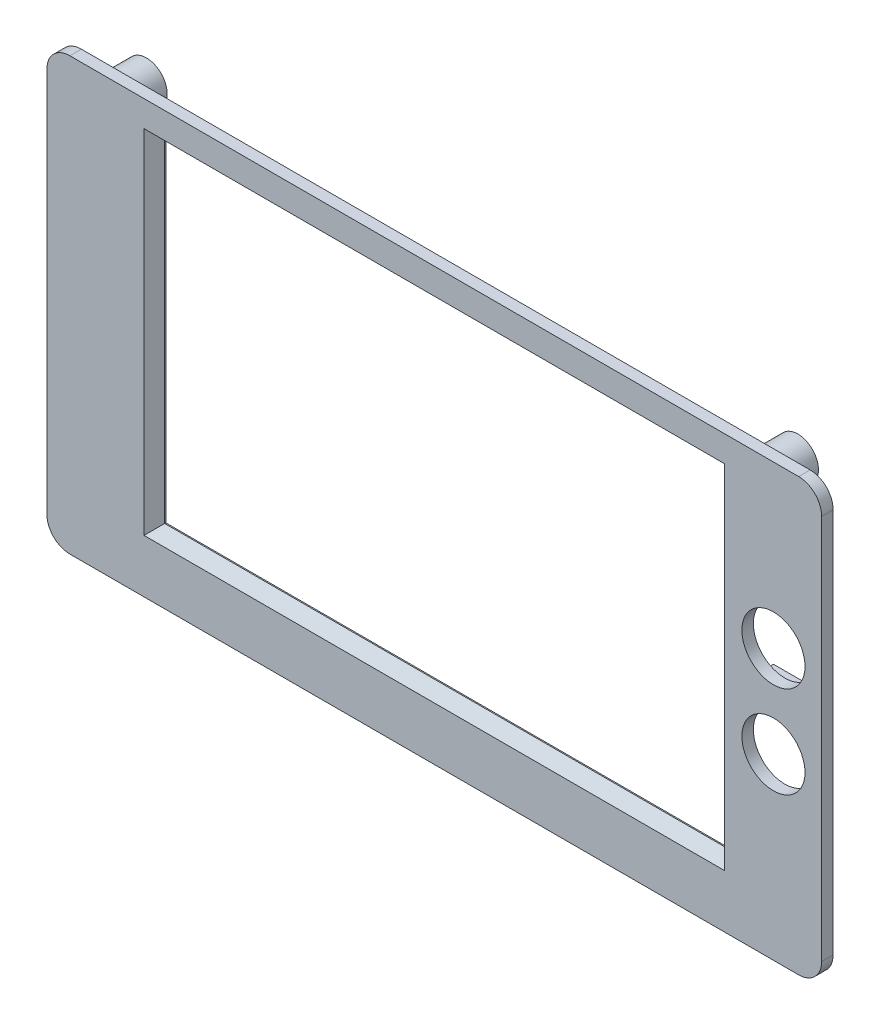
from build123d import *

# Parameters (mm, degrees)
SKETCH_3_W            = 95.96
SKETCH_3_H            = 56.19
EXTRUDE_2_DEPTH       = 2
SKETCH_4_W            = 97.56
SKETCH_4_H            = 57.79
SKETCH_4_W_2          = 95.96
SKETCH_4_H_2          = 56.19
CUT_EXTRUDE_1_DEPTH   = 2
SKETCH_5_R            = 3.6
SKETCH_5_R_2          = 2.4
EXTRUDE_1_DEPTH       = 4.6
EXTRUDE_START         = -2
EXTRUDE_3_DEPTH       = 2
CHAMFER_1_SIZE        = 1.8
SKETCH_8_W            = 10
SKETCH_8_H            = 75.2
EXTRUDE_3_2_DEPTH     = 2
FILLET_1_R            = 4
SKETCH_9_R            = 5.5
CUT_EXTRUDE_1_2_DEPTH = 2
SKETCH_11_R           = 2.4
SKETCH_11_R_2         = 1
EXTRUDE_4_DEPTH       = 4.6
SKETCH_14_W           = 10
SKETCH_14_H           = 1
EXTRUDE_4_2_DEPTH     = 3
CHAMFER_2_SIZE        = 3
CHAMFER_3_SIZE        = 3


with BuildPart() as part:
    # Эскиз3 → Бобышка-Вытянуть2 (new body)
    with BuildSketch(Plane.XY):
        with BuildLine():
            Line((-57.5, -37), (57.5, -37))
            ThreePointArc((57.5, -37), (59.267766953, -36.267766953), (60, -34.5))
            Line((60, -34.5), (60, 34.5))
            ThreePointArc((60, 34.5), (59.267766953, 36.267766953), (57.5, 37))
            Line((57.5, 37), (-57.5, 37))
            ThreePointArc((-57.5, 37), (-59.267766953, 36.267766953), (-60, 34.5))
            Line((-60, 34.5), (-60, -34.5))
            ThreePointArc((-60, -34.5), (-59.267766953, -36.267766953), (-57.5, -37))
        make_face()
        with Locations((0, 2.375)):
            Rectangle(SKETCH_3_W, SKETCH_3_H, mode=Mode.SUBTRACT)
    extrude(amount=EXTRUDE_2_DEPTH)

    # Эскиз4 → Cut-Extrude 1 (cut)
    with BuildSketch(Plane.XY.offset(2)):
        with Locations((0, 2.375)):
            Rectangle(SKETCH_4_W, SKETCH_4_H)
        with Locations((0, 2.375)):
            Rectangle(SKETCH_4_W_2, SKETCH_4_H_2, mode=Mode.SUBTRACT)
    extrude(amount=-CUT_EXTRUDE_1_DEPTH, mode=Mode.SUBTRACT)

    # Эскиз5 → Вытянуть-Тонкостенный1 (add)
    # profile 1 of 4: a face of its own
    with BuildSketch(Plane(origin=(0, 0, 0), x_dir=(-1, 0, 0), z_dir=(0, 0, -1))):
        with Locations((56.75, 33.75)):
            Circle(SKETCH_5_R)
        with Locations((56.75, 33.75)):
            Circle(SKETCH_5_R_2, mode=Mode.SUBTRACT)
    # profile 2 of 4: a face of its own
    with BuildSketch(Plane(origin=(0, 0, 0), x_dir=(-1, 0, 0), z_dir=(0, 0, -1))):
        with Locations((-56.75, 33.75)):
            Circle(SKETCH_5_R)
        with Locations((-56.75, 33.75)):
            Circle(SKETCH_5_R_2, mode=Mode.SUBTRACT)
    # profile 3 of 4: a face of its own
    with BuildSketch(Plane(origin=(0, 0, 0), x_dir=(-1, 0, 0), z_dir=(0, 0, -1))):
        with Locations((-56.75, -33.75)):
            Circle(SKETCH_5_R)
        with Locations((-56.75, -33.75)):
            Circle(SKETCH_5_R_2, mode=Mode.SUBTRACT)
    # profile 4 of 4: a face of its own
    with BuildSketch(Plane(origin=(0, 0, 0), x_dir=(-1, 0, 0), z_dir=(0, 0, -1))):
        with Locations((56.75, -33.75)):
            Circle(SKETCH_5_R)
        with Locations((56.75, -33.75)):
            Circle(SKETCH_5_R_2, mode=Mode.SUBTRACT)
    extrude(amount=EXTRUDE_1_DEPTH)

    # Эскиз7 → Extrude 3 (add)
    with BuildSketch(Plane.XY.offset(2).offset(EXTRUDE_START)):
        with BuildLine():
            Line((-60.6, 34.5), (-60.6, -34.5))
            ThreePointArc((-60.6, -34.5), (-59.692031022, -36.692031022), (-57.5, -37.6))
            Line((-57.5, -37.6), (57.5, -37.6))
            ThreePointArc((57.5, -37.6), (59.692031022, -36.692031022), (60.6, -34.5))
            Line((60.6, -34.5), (60.6, 34.5))
            ThreePointArc((60.6, 34.5), (59.692031022, 36.692031022), (57.5, 37.6))
            Line((57.5, 37.6), (-57.5, 37.6))
            ThreePointArc((-57.5, 37.6), (-59.692031022, 36.692031022), (-60.6, 34.5))
        make_face()
        with BuildLine():
            Line((-60, 34.5), (-60, -34.5))
            ThreePointArc((-60, -34.5), (-59.267766953, -36.267766953), (-57.5, -37))
            Line((-57.5, -37), (57.5, -37))
            ThreePointArc((57.5, -37), (59.267766953, -36.267766953), (60, -34.5))
            Line((60, -34.5), (60, 34.5))
            ThreePointArc((60, 34.5), (59.267766953, 36.267766953), (57.5, 37))
            Line((57.5, 37), (-57.5, 37))
            ThreePointArc((-57.5, 37), (-59.267766953, 36.267766953), (-60, 34.5))
        make_face(mode=Mode.SUBTRACT)
    extrude(amount=EXTRUDE_3_DEPTH)

    # Фаска1
    chamfer_1_edges = [part.edges().sort_by_distance(p)[0] for p in [
        (0, 31.27, 2),
        (-48.78, 2.375, 2),
        (0, -26.52, 2),
        (48.78, 2.375, 2),
    ]]
    chamfer(chamfer_1_edges, length=CHAMFER_1_SIZE)

    # Эскиз8 → Extrude 3 2 (add)
    with BuildSketch(Plane.XY.offset(2)):
        with Locations((62.5, 0)):
            Rectangle(SKETCH_8_W, SKETCH_8_H)
        with Locations((-62.5, 0)):
            Rectangle(SKETCH_8_W, SKETCH_8_H)
    extrude(amount=-EXTRUDE_3_2_DEPTH)

    # Скругление1
    fillet_1_edges = [part.edges().sort_by_distance(p)[0] for p in [
        (67.5, 37.6, 1),
        (67.5, -37.6, 1),
        (-67.5, -37.6, 1),
        (-67.5, 37.6, 1),
    ]]
    fillet(fillet_1_edges, radius=FILLET_1_R)

    # Эскиз9 → Cut-Extrude 1 2 (cut)
    with BuildSketch(Plane.XY.offset(2)):
        with Locations((59.1, 9.48)):
            Circle(SKETCH_9_R)
        with Locations((59.1, -6.52)):
            Circle(SKETCH_9_R)
    extrude(amount=-CUT_EXTRUDE_1_2_DEPTH, mode=Mode.SUBTRACT)

    # Эскиз11 → Extrude 4 (add)
    # profile 1 of 4: a face of its own
    with BuildSketch(Plane(origin=(0, 0, 0), x_dir=(-1, 0, 0), z_dir=(0, 0, -1))):
        with Locations((-56.75, 33.75)):
            Circle(SKETCH_11_R)
        with Locations((-56.75, 33.75)):
            Circle(SKETCH_11_R_2, mode=Mode.SUBTRACT)
    # profile 2 of 4: a face of its own
    with BuildSketch(Plane(origin=(0, 0, 0), x_dir=(-1, 0, 0), z_dir=(0, 0, -1))):
        with Locations((56.75, 33.75)):
            Circle(SKETCH_11_R)
        with Locations((56.75, 33.75)):
            Circle(SKETCH_11_R_2, mode=Mode.SUBTRACT)
    # profile 3 of 4: a face of its own
    with BuildSketch(Plane(origin=(0, 0, 0), x_dir=(-1, 0, 0), z_dir=(0, 0, -1))):
        with Locations((56.75, -33.75)):
            Circle(SKETCH_11_R)
        with Locations((56.75, -33.75)):
            Circle(SKETCH_11_R_2, mode=Mode.SUBTRACT)
    # profile 4 of 4: a face of its own
    with BuildSketch(Plane(origin=(0, 0, 0), x_dir=(-1, 0, 0), z_dir=(0, 0, -1))):
        with Locations((-56.75, -33.75)):
            Circle(SKETCH_11_R)
        with Locations((-56.75, -33.75)):
            Circle(SKETCH_11_R_2, mode=Mode.SUBTRACT)
    extrude(amount=EXTRUDE_4_DEPTH)

    # Эскиз14 → Extrude 4 2 (add)
    with BuildSketch(Plane(origin=(0, 0, 0), x_dir=(-1, 0, 0), z_dir=(0, 0, -1))):
        with Locations((-59.1, 17.98)):
            Rectangle(SKETCH_14_W, SKETCH_14_H)
        with Locations((-59.1, 1.58)):
            Rectangle(SKETCH_14_W, SKETCH_14_H)
        with Locations((-59.1, -16.02)):
            Rectangle(SKETCH_14_W, SKETCH_14_H)
    extrude(amount=EXTRUDE_4_2_DEPTH)

    # Фаска2
    chamfer_2_edges = [part.edges().sort_by_distance(p)[0] for p in [
        (59.1, 18.48, 0),
    ]]
    chamfer(chamfer_2_edges, length=CHAMFER_2_SIZE - 0.0001)  # a hair under: the kernel refuses the full size

    # Фаска3
    chamfer_3_edges = [part.edges().sort_by_distance(p)[0] for p in [
        (59.1, -16.52, 0),
    ]]
    chamfer(chamfer_3_edges, length=CHAMFER_3_SIZE - 0.0001)  # a hair under: the kernel refuses the full size


solid = part.part
